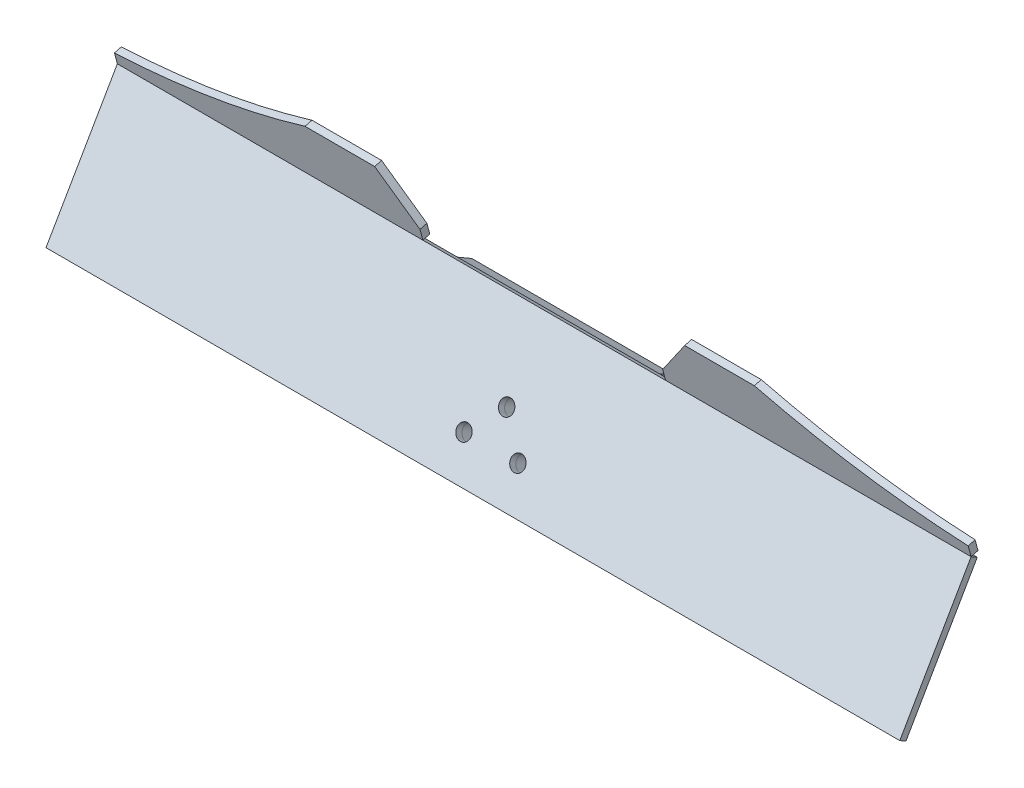
from build123d import *

# Parameters (mm, degrees)
BOSS_EXTRUDE1_DEPTH                 = 190
BOSS_EXTRUDE2_START                 = 54
BOSS_EXTRUDE2_DEPTH                 = 136
CUT_EXTRUDE1_DEPTH                  = 207.570315507
BOSS_EXTRUDE4_DEPTH                 = 20
BOSS_EXTRUDE5_DEPTH                 = 20
BOSS_EXTRUDE6_DEPTH                 = 20
F_12_CLEARANCE_HOLE1_AT_2_COUNT     = 2
F_12_CLEARANCE_HOLE1_AT_2_PITCH     = 16.6
F_12_CLEARANCE_HOLE1_AT_3_COUNT     = 2
F_12_CLEARANCE_HOLE1_AT_3_PITCH     = 30.847366176
F_12_CLEARANCE_HOLE1_AT_4_COUNT     = 2
F_12_CLEARANCE_HOLE1_AT_4_PITCH     = 26
SKETCH15_W                          = 2.4
SKETCH15_H                          = 44.527659988
F_4_8_4_8_DIAMETER_HOLE1_AT_2_COUNT = 2
F_4_8_4_8_DIAMETER_HOLE1_AT_2_PITCH = 26
ADVANCEDHOLE6_START                 = -22.903544809
ADVANCEDHOLE6_OUTLINE_R             = 5.75
ADVANCEDHOLE6_DEPTH                 = 14.705171087
SKETCH16_R                          = 3.68060844
CUT_EXTRUDE2_DEPTH                  = 208.600838038
ADVANCEDHOLE2_START                 = -3.175
ADVANCEDHOLE2_OUTLINE_R             = 3.2639
ADVANCEDHOLE2_DEPTH                 = 12.35
BOSS_EXTRUDE7_START                 = 20
BOSS_EXTRUDE7_DEPTH                 = 25
BOSS_EXTRUDE8_START                 = -20
BOSS_EXTRUDE8_DEPTH                 = 25


# Read off the part's stored shape, not the designer's step: AdvancedHole6, AdvancedHole2
with BuildPart() as part:
    # Sketch1 → Boss-Extrude1 (new, symmetric)
    with BuildSketch(Plane(origin=(0, 0, 0), x_dir=(0, 0, -1), z_dir=(1, 0, 0))):
        Polygon((-9.699484522, -4.8), (22.054780283, 50.2), (19.305149626, 51.7875), (-12.449115179, -3.2125), align=None)
    extrude(amount=BOSS_EXTRUDE1_DEPTH, both=True)


with BuildPart() as body_2:
    # Sketch1<4> → Boss-Extrude2 (new body)
    with BuildSketch(Plane(origin=(0, 0, 0), x_dir=(0, 0, -1), z_dir=(1, 0, 0)).offset(BOSS_EXTRUDE2_START)):
        Polygon((19.305149626, 51.7875), (22.371964124, 52.609250468), (15.901487997, 76.757396125), (12.834673498, 75.935645657), align=None)
    extrude(amount=BOSS_EXTRUDE2_DEPTH)

    # Sketch2 → Cut-Extrude1 (cut, through all)
    with BuildSketch(Plane(origin=(0, 8.295392107, -30.958824813), x_dir=(1, 0, 0), z_dir=(0, -0.25881904510252507, 0.9659258262890673))):
        Polygon((54, 50.026343337), (69, 70.026343337), (54, 70.026343337), align=None)
        with BuildLine():
            ThreePointArc((100, 70.026343337), (144.24878754, 56.645887268), (190, 50.026343337))
            Line((190, 50.026343337), (190, 70.026343337))
            Line((190, 70.026343337), (100, 70.026343337))
        make_face()
    extrude(amount=-CUT_EXTRUDE1_DEPTH, mode=Mode.SUBTRACT)


with BuildPart() as body_3:
    # Mirror1: mirrored copy
    add(body_2.part.mirror(Plane(origin=(0, 0, 0), x_dir=(0, 0, 1), z_dir=(1, 0, 0))))


with BuildPart() as body_4:
    # Sketch1<5> → Boss-Extrude4 (new, symmetric)
    with BuildSketch(Plane(origin=(0, 0, 0), x_dir=(0, 0, -1), z_dir=(1, 0, 0))):
        Polygon((21.389551727, 49.047790342), (-6.92820323, 0), (0, 0), (16, 27.712812921), (21.694800836, 37.576497308), (22.903544809, 37.576497308), (26.078544809, 37.576497308), (26.078544809, 12.35), (26.078544809, 3.35), (32.078544809, 3.35), (32.078544809, 42.876497308), align=None)
    extrude(amount=BOSS_EXTRUDE4_DEPTH, both=True)


with BuildPart() as body_5:
    # Sketch1<6> → Boss-Extrude5 (new, symmetric)
    with BuildSketch(Plane(origin=(0, 0, 0), x_dir=(0, 0, -1), z_dir=(1, 0, 0))):
        Polygon((2.749630657, -1.5875), (18.749630657, 26.125312921), (16, 27.712812921), (0, 0), align=None)
    extrude(amount=BOSS_EXTRUDE5_DEPTH, both=True)

    # Sketch16 → Cut-Extrude2 (cut, through all)
    with BuildSketch(Plane(origin=(0, -1.5875, -2.749630657), x_dir=(-1, 0, 0), z_dir=(0, -0.49999999999999756, -0.86602540378444))):
        with Locations(Location((13, 18.633980412, 0), (0, 0, 90))):
            Circle(SKETCH16_R)
        with Locations(Location((-13, 18.633980412, 0), (0, 0, 90))):
            Circle(SKETCH16_R)
    extrude(amount=-CUT_EXTRUDE2_DEPTH, mode=Mode.SUBTRACT)


with BuildPart() as body_6:
    # Sketch1<7> → Boss-Extrude6 (new, symmetric)
    with BuildSketch(Plane(origin=(0, 0, 0), x_dir=(0, 0, -1), z_dir=(1, 0, 0))):
        Polygon((22.903544809, 37.576497308), (22.903544809, 3.35), (26.078544809, 3.35), (26.078544809, 12.35), (26.078544809, 37.576497308), align=None)
    extrude(amount=BOSS_EXTRUDE6_DEPTH, both=True)


with BuildPart() as f_12_clearance_hole1_tool:
    # Sketch8 → #12 Clearance Hole1 (revolve)
    with BuildSketch(Plane(origin=(13, 15.35, -32.078544809), x_dir=(0, 1, 0), z_dir=(1, 0, 0))):
        Polygon((0, 0), (0, 11.686435499), (2.8067, 10), (2.8067, 0), align=None)
    f_12_clearance_hole1 = revolve(axis=Axis((13, 15.35, -38.428544809), (0, 0, 1)))


with BuildPart() as body_4_1:
    add(body_4.part)

    # #12 Clearance Hole1: cut by f_12_clearance_hole1_tool
    add(f_12_clearance_hole1_tool.part, mode=Mode.SUBTRACT)


with BuildPart() as body_6_1:
    add(body_6.part)

    # #12 Clearance Hole1: cut by f_12_clearance_hole1_tool
    add(f_12_clearance_hole1_tool.part, mode=Mode.SUBTRACT)


with BuildPart() as f_12_clearance_hole1_at_2_tool:
    # #12 Clearance Hole1 at 2: #12 Clearance Hole1 ×2
    with Locations(*[(0, i * F_12_CLEARANCE_HOLE1_AT_2_PITCH, 0) for i in range(1, F_12_CLEARANCE_HOLE1_AT_2_COUNT)]):
        add(f_12_clearance_hole1)


with BuildPart() as body_4_2:
    add(body_4_1.part)

    # #12 Clearance Hole1 at 2: cut by f_12_clearance_hole1_at_2_tool
    add(f_12_clearance_hole1_at_2_tool.part, mode=Mode.SUBTRACT)


with BuildPart() as body_6_2:
    add(body_6_1.part)

    # #12 Clearance Hole1 at 2: cut by f_12_clearance_hole1_at_2_tool
    add(f_12_clearance_hole1_at_2_tool.part, mode=Mode.SUBTRACT)


with BuildPart() as f_12_clearance_hole1_at_3_tool:
    # #12 Clearance Hole1 at 3: #12 Clearance Hole1 ×2
    with Locations(*[Vector(-0.842859641617543, 0.5381334634942776, 0) * (i * F_12_CLEARANCE_HOLE1_AT_3_PITCH) for i in range(1, F_12_CLEARANCE_HOLE1_AT_3_COUNT)]):
        add(f_12_clearance_hole1)


with BuildPart() as body_4_3:
    add(body_4_2.part)

    # #12 Clearance Hole1 at 3: cut by f_12_clearance_hole1_at_3_tool
    add(f_12_clearance_hole1_at_3_tool.part, mode=Mode.SUBTRACT)


with BuildPart() as body_6_3:
    add(body_6_2.part)

    # #12 Clearance Hole1 at 3: cut by f_12_clearance_hole1_at_3_tool
    add(f_12_clearance_hole1_at_3_tool.part, mode=Mode.SUBTRACT)


with BuildPart() as f_12_clearance_hole1_at_4_tool:
    # #12 Clearance Hole1 at 4: #12 Clearance Hole1 ×2
    with Locations(*[(-i * F_12_CLEARANCE_HOLE1_AT_4_PITCH, 0, 0) for i in range(1, F_12_CLEARANCE_HOLE1_AT_4_COUNT)]):
        add(f_12_clearance_hole1)


with BuildPart() as body_4_4:
    add(body_4_3.part)

    # #12 Clearance Hole1 at 4: cut by f_12_clearance_hole1_at_4_tool
    add(f_12_clearance_hole1_at_4_tool.part, mode=Mode.SUBTRACT)

    # Sketch15 → Ø4.8 (4.8) Diameter Hole1 (revolve, cut)
    with BuildSketch(Plane(origin=(-13, 15.35, -32.078544809), x_dir=(0, 1, 0), z_dir=(1, 0, 0))):
        with Locations((1.2, 22.263829994)):
            Rectangle(SKETCH15_W, SKETCH15_H)
    f_4_8_4_8_diameter_hole1 = revolve(axis=Axis((-13, 15.35, -38.428544809), (0, 0, 1)), mode=Mode.SUBTRACT)

    # Ø4.8 (4.8) Diameter Hole1 at 2: Ø4.8 (4.8) Diameter Hole1 ×2
    with Locations(*[(i * F_4_8_4_8_DIAMETER_HOLE1_AT_2_PITCH, 0, 0) for i in range(1, F_4_8_4_8_DIAMETER_HOLE1_AT_2_COUNT)]):
        add(f_4_8_4_8_diameter_hole1, mode=Mode.SUBTRACT)

    # AdvancedHole6 outline → AdvancedHole6 (cut)
    with BuildSketch(Plane.XY.offset(ADVANCEDHOLE6_START)):
        with Locations((-13, 31.95)):
            Circle(ADVANCEDHOLE6_OUTLINE_R)
        with Locations((13, 31.95)):
            Circle(ADVANCEDHOLE6_OUTLINE_R)
    extrude(amount=ADVANCEDHOLE6_DEPTH, mode=Mode.SUBTRACT)


with BuildPart() as body_6_4:
    add(body_6_3.part)

    # #12 Clearance Hole1 at 4: cut by f_12_clearance_hole1_at_4_tool
    add(f_12_clearance_hole1_at_4_tool.part, mode=Mode.SUBTRACT)


with BuildPart() as advancedhole2_tool:
    # AdvancedHole2 outline → AdvancedHole2 (new body)
    with BuildSketch(Plane(origin=(0, 0, 0), x_dir=(1, 0, 0), z_dir=(0, 0.49999999999999795, 0.8660254037844399)).offset(ADVANCEDHOLE2_START)):
        with Locations((0, 21.07179677)):
            Circle(ADVANCEDHOLE2_OUTLINE_R)
        with Locations((-12, 7.07179677)):
            Circle(ADVANCEDHOLE2_OUTLINE_R)
        with Locations((12, 7.07179677)):
            Circle(ADVANCEDHOLE2_OUTLINE_R)
    extrude(amount=ADVANCEDHOLE2_DEPTH)


with BuildPart() as part_1:
    add(part.part)

    # AdvancedHole2: cut by advancedhole2_tool
    add(advancedhole2_tool.part, mode=Mode.SUBTRACT)


with BuildPart() as body_4_5:
    add(body_4_4.part)

    # AdvancedHole2: cut by advancedhole2_tool
    add(advancedhole2_tool.part, mode=Mode.SUBTRACT)

    # Sketch1<8> → Boss-Extrude7 (add)
    with BuildSketch(Plane(origin=(0, 0, 0), x_dir=(0, 0, -1), z_dir=(1, 0, 0)).offset(BOSS_EXTRUDE7_START)):
        Polygon((21.389551727, 49.047790342), (-6.92820323, 0), (0, 0), (22.903544809, 3.35), (32.078544809, 3.35), (32.078544809, 42.876497308), align=None)
    extrude(amount=BOSS_EXTRUDE7_DEPTH)

    # Sketch1<9> → Boss-Extrude8 (add)
    with BuildSketch(Plane(origin=(0, 0, 0), x_dir=(0, 0, -1), z_dir=(1, 0, 0)).offset(BOSS_EXTRUDE8_START)):
        Polygon((21.389551727, 49.047790342), (-6.92820323, 0), (0, 0), (22.903544809, 3.35), (32.078544809, 3.35), (32.078544809, 42.876497308), align=None)
    extrude(amount=-BOSS_EXTRUDE8_DEPTH)


with BuildPart() as body_5_1:
    add(body_5.part)

    # AdvancedHole2: cut by advancedhole2_tool
    add(advancedhole2_tool.part, mode=Mode.SUBTRACT)


solid = Compound([body_2.part, body_3.part, body_6_4.part, part_1.part, body_4_5.part, body_5_1.part])
